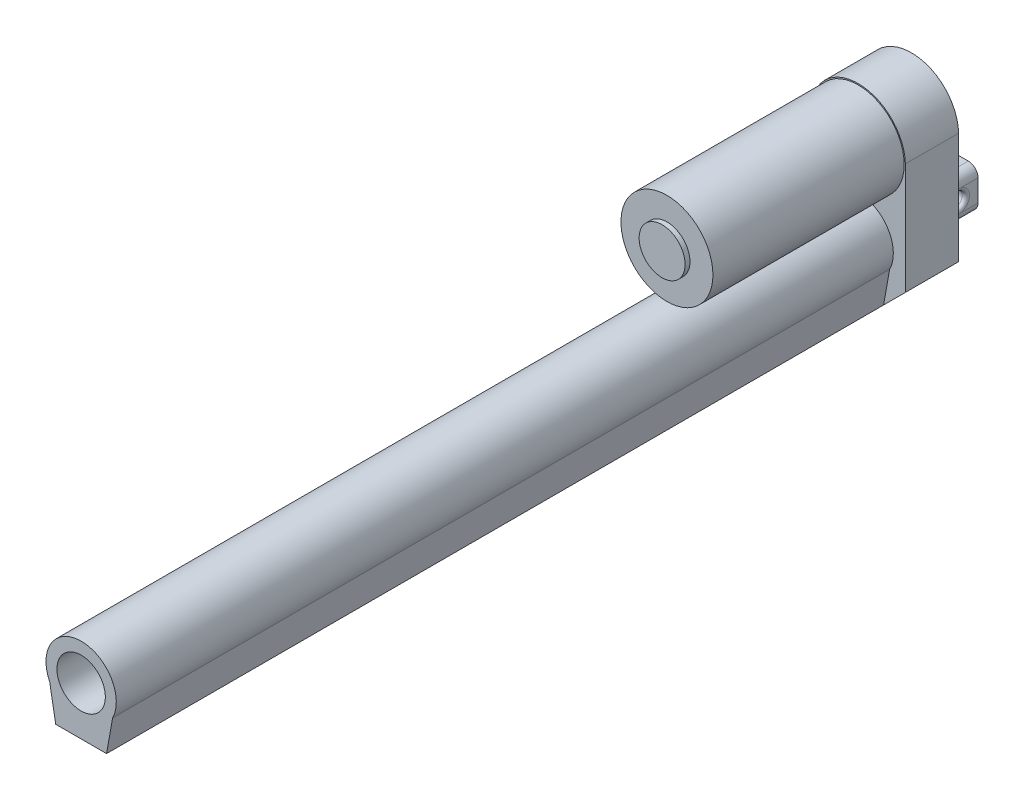
from build123d import *

# Parameters (mm, degrees)
SALIENTE_EXTRUIR1_DEPTH = 22
CROQUIS2_R              = 19
SALIENTE_EXTRUIR2_DEPTH = 79
CROQUIS3_R              = 9.5
SALIENTE_EXTRUIR3_DEPTH = 2
SALIENTE_EXTRUIR4_DEPTH = 321
CROQUIS5_R              = 10
CORTAR_EXTRUIR1_DEPTH   = 321
SALIENTE_EXTRUIR5_DEPTH = 19
CORTAR_EXTRUIR2_REACH   = 354.007
CROQUIS8_R              = 3
REDONDEO1_R             = 1.5


with BuildPart() as part:
    # Croquis1 → Saliente-Extruir1 (new body)
    with BuildSketch(Plane.XY):
        with BuildLine():
            Line((-9, 0), (-30, 0))
            Line((-30, 0), (-39, 9))
            Line((-39, 9), (-39, 54.9875))
            ThreePointArc((-39, 54.9875), (-19.5, 74), (0, 54.9875))
            Line((0, 54.9875), (0, 9))
            Line((0, 9), (-9, 0))
        make_face()
    extrude(amount=SALIENTE_EXTRUIR1_DEPTH)

    # Croquis2 → Saliente-Extruir2 (add)
    with BuildSketch(Plane.XY.offset(22)):
        with Locations((-19.5, 54.5)):
            Circle(CROQUIS2_R)
    extrude(amount=SALIENTE_EXTRUIR2_DEPTH)

    # Croquis3 → Saliente-Extruir3 (add)
    with BuildSketch(Plane.XY.offset(101)):
        with Locations((-19.5, 54.5)):
            Circle(CROQUIS3_R)
    extrude(amount=SALIENTE_EXTRUIR3_DEPTH)

    # Croquis4 → Saliente-Extruir4 (add)
    with BuildSketch(Plane.XY.offset(22)):
        with BuildLine():
            Line((-32.5, 14), (-30, 0))
            Line((-30, 0), (-9, 0))
            Line((-9, 0), (-6.5, 14))
            ThreePointArc((-6.5, 14), (-19.5, 35.001407257), (-32.5, 14))
        make_face()
    extrude(amount=SALIENTE_EXTRUIR4_DEPTH)

    # Croquis5 → Cortar-Extruir1 (cut)
    with BuildSketch(Plane.XY.offset(343)):
        with Locations((-19.5, 20.001407257)):
            Circle(CROQUIS5_R)
    extrude(amount=-CORTAR_EXTRUIR1_DEPTH, mode=Mode.SUBTRACT)

    # Croquis6 → Saliente-Extruir5 (add)
    with BuildSketch(Plane(origin=(0, 0, 0), x_dir=(-1, 0, 0), z_dir=(0, 0, -1))):
        with BuildLine():
            Line((24, 11), (19.5, 11))
            Line((19.5, 11), (15, 11))
            ThreePointArc((15, 11), (12.171572875, 12.171572875), (11, 15))
            Line((11, 15), (11, 24))
            ThreePointArc((11, 24), (12.171572875, 26.828427125), (15, 28))
            Line((15, 28), (24, 28))
            ThreePointArc((24, 28), (26.828427125, 26.828427125), (28, 24))
            Line((28, 24), (28, 15))
            ThreePointArc((28, 15), (26.828427125, 12.171572875), (24, 11))
        make_face()
    extrude(amount=SALIENTE_EXTRUIR5_DEPTH)

    # Croquis8 → Cortar-Extruir2 (cut, up to next)
    with BuildSketch(Plane(origin=(-11, 0, 0), x_dir=(0, 0, -1), z_dir=(1, 0, 0)), mode=Mode.PRIVATE) as cortar_extruir2_sk1:
        with Locations(Location((11, 19.5, 0), (0, 0, 90))):
            Circle(CROQUIS8_R)
    cortar_extruir2_tool1 = extrude(cortar_extruir2_sk1.sketch, amount=-CORTAR_EXTRUIR2_REACH, mode=Mode.PRIVATE) & part.part
    add(cortar_extruir2_tool1.solids().sort_by_distance((-11, 19.5, -11))[0], mode=Mode.SUBTRACT)

    # Redondeo1
    redondeo1_edges = [part.edges().sort_by_distance(p)[0] for p in [
        (-11, 16.5, -11),
        (-28, 16.5, -11),
    ]]
    fillet(redondeo1_edges, radius=REDONDEO1_R - 0.0001)  # a hair under: the kernel refuses the full size


solid = part.part
